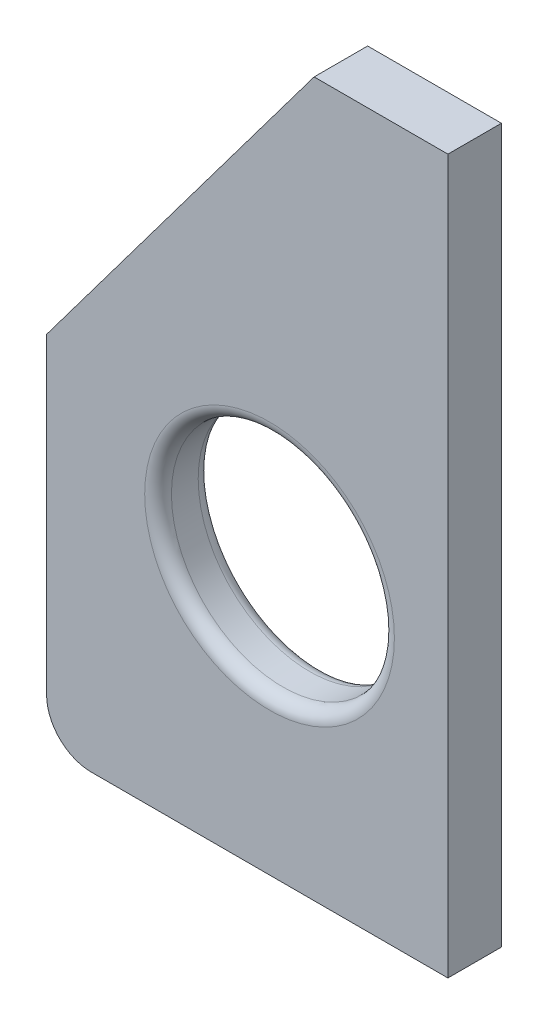
from build123d import *

# Parameters (mm, degrees)
SM_BASE_FLANGE_1_DEPTH = 12
SKETCH_2_R             = 25
CUT_EXTRUDE_1_DEPTH    = 184.967388414
FILLET_1_R             = 3


# Sheet-metal steps are written as plain solids
with BuildPart() as part:
    # Sketch 1 → 基体-法兰1 (new body)
    with BuildSketch(Plane.XY):
        with BuildLine():
            Line((-30, 0), (-90, -80))
            Line((-90, -80), (-90, -150))
            ThreePointArc((-90, -150), (-87.071067812, -157.071067812), (-80, -160))
            Line((-80, -160), (0, -160))
            Line((0, -160), (0, 0))
            Line((0, 0), (-30, 0))
        make_face()
    extrude(amount=-SM_BASE_FLANGE_1_DEPTH)

    # Sketch 2 → 切除-拉伸1 (cut, through all)
    with BuildSketch(Plane.XY):
        with Locations((-40, -100)):
            Circle(SKETCH_2_R)
    extrude(amount=-CUT_EXTRUDE_1_DEPTH, mode=Mode.SUBTRACT)

    # 圆角1
    fillet_1_edges = [part.edges().sort_by_distance(p)[0] for p in [
        (-65, -100, -12),
        (-65, -100, 0),
    ]]
    fillet(fillet_1_edges, radius=FILLET_1_R)


solid = part.part
